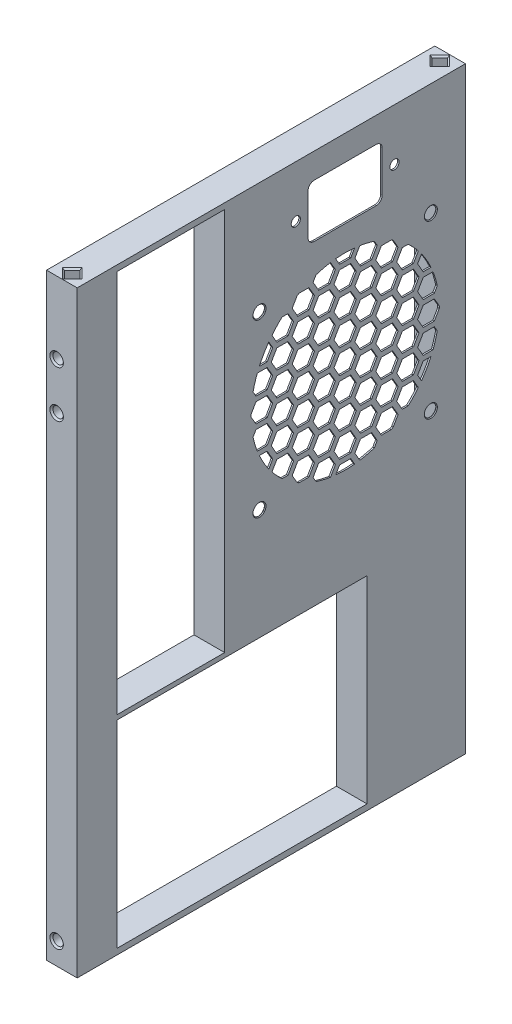
from build123d import *

# Parameters (mm, degrees)
SKETCH47_W                             = 160.866666667
SKETCH47_H                             = 247.65
SKETCH47_W_2                           = 44.704
SKETCH47_H_2                           = 159.004
SKETCH47_W_3                           = 103.7209
SKETCH47_H_3                           = 81.915
BOSS_EXTRUDE1_DEPTH                    = 12.7
BOSS_EXTRUDE6_DEPTH                    = 0.635
CUT_EXTRUDE4_REACH                     = 159.21
POWER_CABLE_ADAPTER_SCREWHOLES_D       = 3.7973
GPU_MOUNTING_SCREWHOLES_D              = 4.3053
GPU_MOUNTING_SCREWHOLES_DEPTH          = 4.572
GPU_MOUNTING_SCREWHOLES_CSINK_D        = 5.5753
GPU_MOUNTING_SCREWHOLES_CSINK_ANGLE    = 90
GPU_MOUNTING_SCREWHOLES_TIP            = 1.293442612
GPU_SCREW_ACCESS_HOLES_REACH           = 207.287
CUT_EXTRUDE1_REACH                     = 159.21
FILL_START                             = 12.065
FILL_PATTERN1_DEPTH                    = 0.635
SKETCH64_W                             = 82.922533333
SKETCH64_H                             = 128.9685
SKETCH64_R                             = 39
BOSS_EXTRUDE7_DEPTH                    = 0.635
F_3_16_0_1875_DIAMETER_HOLE1_D         = 4.7625
F_3_16_0_1875_DIAMETER_HOLE1_DEPTH     = 5.588
F_3_16_0_1875_DIAMETER_HOLE1_TIP       = 1.430799349
CHAMFER2_SIZE                          = 0.3175
BOTTOM_PINS_DEPTH                      = 6.35
FRONT_PINS_DEPTH                       = 6.35
CUT_EXTRUDE3_DEPTH                     = 6.35
PIN_CHAMFER_SIZE                       = 0.635
SKETCH69_W                             = 13.216466667
SKETCH69_H                             = 81.915
CUT_EXTRUDE2_DEPTH                     = 1.27
F_18_0_1695_DIAMETER_HOLE3_D           = 4.3053
F_18_0_1695_DIAMETER_HOLE3_DEPTH       = 8.382
F_18_0_1695_DIAMETER_HOLE3_CSINK_D     = 5.5753
F_18_0_1695_DIAMETER_HOLE3_CSINK_ANGLE = 90
F_18_0_1695_DIAMETER_HOLE3_TIP         = 1.293442612


# Read off the part's stored shape, not the designer's step: Fill Pattern1, #18 (0.1695) Diameter Hole2
with BuildPart() as part:
    # Sketch47 → Boss-Extrude1 (new body)
    with BuildSketch(Plane(origin=(0, 0, 0), x_dir=(0, 0, -1), z_dir=(1, 0, 0))):
        with Locations((11.578166667, 3.0734)):
            Rectangle(SKETCH47_W, SKETCH47_H)
        with Locations((-30.1117, 44.9834)):
            Rectangle(SKETCH47_W_2, SKETCH47_H_2, mode=Mode.SUBTRACT)
        Polygon((83.6295, 124.4854), (83.6295, -105.70845), (70.99935, -118.3386), (58.3692, -118.3386), (58.3692, -34.5186), (0.706966667, -34.5186), (0.706966667, 124.4854), align=None, mode=Mode.SUBTRACT)
        with Locations((-0.60325, -77.3811)):
            Rectangle(SKETCH47_W_3, SKETCH47_H_3, mode=Mode.SUBTRACT)
    extrude(amount=BOSS_EXTRUDE1_DEPTH)

    # Sketch50 → Boss-Extrude6 (add)
    with BuildSketch(Plane.ZY.offset(-12.7)):
        Polygon((-58.3692, -34.5186), (-58.3692, -118.3386), (-83.6295, -118.3386), (-83.6295, 124.4854), (-0.706966667, 124.4854), (-0.706966667, -34.5186), align=None)
    extrude(amount=BOSS_EXTRUDE6_DEPTH)

    # Sketch73 → Cut-Extrude4 (cut, up to next)
    with BuildSketch(Plane.ZY.offset(-12.065), mode=Mode.PRIVATE) as cut_extrude4_sk1:
        with BuildLine():
            Line((-26.801233333, 96.9899), (-26.801233333, 113.8809))
            ThreePointArc((-26.801233333, 113.8809), (-27.545182109, 115.676951224), (-29.341233333, 116.4209))
            Line((-29.341233333, 116.4209), (-54.995233333, 116.4209))
            ThreePointArc((-54.995233333, 116.4209), (-56.791284558, 115.676951224), (-57.535233333, 113.8809))
            Line((-57.535233333, 113.8809), (-57.535233333, 96.9899))
            ThreePointArc((-57.535233333, 96.9899), (-56.791284558, 95.193848776), (-54.995233333, 94.4499))
            Line((-54.995233333, 94.4499), (-29.341233333, 94.4499))
            ThreePointArc((-29.341233333, 94.4499), (-27.545182109, 95.193848776), (-26.801233333, 96.9899))
        make_face()
    cut_extrude4_tool1 = extrude(cut_extrude4_sk1.sketch, amount=-CUT_EXTRUDE4_REACH, mode=Mode.PRIVATE) & part.part
    add(cut_extrude4_tool1.solids().sort_by_distance((12.065, 105.4354, -42.168233))[0], mode=Mode.SUBTRACT)

    # power cable adapter screwholes (through all)
    with Locations(Plane.ZY.offset(-12.065)):
        with Locations((-62.615233333, 105.4354), (-21.721233333, 105.4354)):
            Hole(POWER_CABLE_ADAPTER_SCREWHOLES_D / 2)

    # GPU mounting screwholes
    with Locations(Plane(origin=(0, 0, -58.3692), x_dir=(-1, 0, 0), z_dir=(0, 0, -1))):
        with Locations((-5.08, -58.800000002), (-5.08, -79.120000002), (-5.08, -99.440000002), (-5.08, -38.354)):
            CounterSinkHole(GPU_MOUNTING_SCREWHOLES_D / 2, GPU_MOUNTING_SCREWHOLES_CSINK_D / 2, depth=GPU_MOUNTING_SCREWHOLES_DEPTH, counter_sink_angle=GPU_MOUNTING_SCREWHOLES_CSINK_ANGLE)
            with Locations((0, 0, -(GPU_MOUNTING_SCREWHOLES_DEPTH + GPU_MOUNTING_SCREWHOLES_TIP / 2))):  # 118° drill point
                Cone(0, GPU_MOUNTING_SCREWHOLES_D / 2, GPU_MOUNTING_SCREWHOLES_TIP, mode=Mode.SUBTRACT)

    # Sketch55 → GPU screw access holes (cut, up to next)
    with BuildSketch(Plane(origin=(0, 0, -92.0115), x_dir=(-1, 0, 0), z_dir=(0, 0, -1)), mode=Mode.PRIVATE) as gpu_screw_access_holes_sk1:
        Polygon((-0.680590949, -38.354), (-2.880295474, -34.544), (-7.279704526, -34.544), (-9.479409051, -38.354), (-7.279704526, -42.164), (-2.880295474, -42.164), align=None)
    gpu_screw_access_holes_tool1 = extrude(gpu_screw_access_holes_sk1.sketch, amount=-GPU_SCREW_ACCESS_HOLES_REACH, mode=Mode.PRIVATE) & part.part
    # Sketch55 → GPU screw access holes (cut, up to next)
    with BuildSketch(Plane(origin=(0, 0, -92.0115), x_dir=(-1, 0, 0), z_dir=(0, 0, -1)), mode=Mode.PRIVATE) as gpu_screw_access_holes_sk2:
        Polygon((-0.680590949, -58.800000002), (-2.880295474, -54.990000002), (-7.279704526, -54.990000002), (-9.479409051, -58.800000002), (-7.279704526, -62.610000002), (-2.880295474, -62.610000002), align=None)
    gpu_screw_access_holes_tool2 = extrude(gpu_screw_access_holes_sk2.sketch, amount=-GPU_SCREW_ACCESS_HOLES_REACH, mode=Mode.PRIVATE) & part.part
    # Sketch55 → GPU screw access holes (cut, up to next)
    with BuildSketch(Plane(origin=(0, 0, -92.0115), x_dir=(-1, 0, 0), z_dir=(0, 0, -1)), mode=Mode.PRIVATE) as gpu_screw_access_holes_sk3:
        Polygon((-0.680590949, -79.120000002), (-2.880295474, -75.310000002), (-7.279704526, -75.310000002), (-9.479409051, -79.120000002), (-7.279704526, -82.930000002), (-2.880295474, -82.930000002), align=None)
    gpu_screw_access_holes_tool3 = extrude(gpu_screw_access_holes_sk3.sketch, amount=-GPU_SCREW_ACCESS_HOLES_REACH, mode=Mode.PRIVATE) & part.part
    # Sketch55 → GPU screw access holes (cut, up to next)
    with BuildSketch(Plane(origin=(0, 0, -92.0115), x_dir=(-1, 0, 0), z_dir=(0, 0, -1)), mode=Mode.PRIVATE) as gpu_screw_access_holes_sk4:
        Polygon((-0.680590949, -99.440000002), (-2.880295474, -95.630000002), (-7.279704526, -95.630000002), (-9.479409051, -99.440000002), (-7.279704526, -103.250000002), (-2.880295474, -103.250000002), align=None)
    gpu_screw_access_holes_tool4 = extrude(gpu_screw_access_holes_sk4.sketch, amount=-GPU_SCREW_ACCESS_HOLES_REACH, mode=Mode.PRIVATE) & part.part
    add(gpu_screw_access_holes_tool1.solids().sort_by_distance((5.08, -38.354, -92.0115))[0], mode=Mode.SUBTRACT)
    add(gpu_screw_access_holes_tool2.solids().sort_by_distance((5.08, -58.8, -92.0115))[0], mode=Mode.SUBTRACT)
    add(gpu_screw_access_holes_tool3.solids().sort_by_distance((5.08, -79.12, -92.0115))[0], mode=Mode.SUBTRACT)
    add(gpu_screw_access_holes_tool4.solids().sort_by_distance((5.08, -99.44, -92.0115))[0], mode=Mode.SUBTRACT)

    # Sketch63 → Cut-Extrude1 (cut, up to next)
    with BuildSketch(Plane.ZY.offset(-12.065), mode=Mode.PRIVATE) as cut_extrude1_sk1:
        Polygon((-37.54943118, 44.9834), (-39.858832257, 48.9834), (-44.47763441, 48.9834), (-46.787035487, 44.9834), (-44.47763441, 40.9834), (-39.858832257, 40.9834), align=None)
    cut_extrude1_tool1 = extrude(cut_extrude1_sk1.sketch, amount=-CUT_EXTRUDE1_REACH, mode=Mode.PRIVATE) & part.part
    add(cut_extrude1_tool1.solids().sort_by_distance((12.065, 44.9834, -42.168233))[0], mode=Mode.SUBTRACT)

    # Fill Pattern1 outline → Fill Pattern1 (cut)
    with BuildSketch(Plane.YZ.offset(FILL_START)):
        Polygon((18.9834, -57.179340332), (14.9834, -54.869939256), (10.9834, -57.179340332), (10.9834, -61.798142486), (14.9834, -64.107543563), (18.9834, -61.798142486), align=None)
        Polygon((33.9834, -48.519086294), (29.9834, -46.209685218), (25.9834, -48.519086294), (25.9834, -53.137888448), (29.9834, -55.447289525), (33.9834, -53.137888448), align=None)
        Polygon((78.9834, -22.538324181), (74.9834, -20.228923104), (70.9834, -22.538324181), (70.9834, -27.157126334), (74.9834, -29.466527411), (78.9834, -27.157126334), align=None)
        Polygon((63.9834, -31.198578219), (59.9834, -28.889177142), (55.9834, -31.198578219), (55.9834, -35.817380372), (59.9834, -38.126781449), (63.9834, -35.817380372), align=None)
        Polygon((44.9834, -54.869939256), (40.9834, -57.179340332), (40.9834, -61.798142486), (44.9834, -64.107543563), (48.9834, -61.798142486), (48.9834, -57.179340332), align=None)
        Polygon((44.9834, -72.190447331), (40.9834, -74.499848408), (40.9834, -79.118650561), (44.9834, -81.428051638), (48.9834, -79.118650561), (48.9834, -74.499848408), align=None)
        Polygon((44.9834, -20.228923104), (40.9834, -22.538324181), (40.9834, -27.157126334), (44.9834, -29.466527411), (48.9834, -27.157126334), (48.9834, -22.538324181), align=None)
        Polygon((44.9834, -2.908415028), (40.9834, -5.217816105), (40.9834, -9.836618259), (44.9834, -12.146019335), (48.9834, -9.836618259), (48.9834, -5.217816105), align=None)
        Polygon((70.9834, -57.179340332), (70.9834, -61.798142486), (74.9834, -64.107543563), (78.9834, -61.798142486), (78.9834, -57.179340332), (74.9834, -54.869939256), align=None)
        Polygon((55.9834, -48.519086294), (55.9834, -53.137888448), (59.9834, -55.447289525), (63.9834, -53.137888448), (63.9834, -48.519086294), (59.9834, -46.209685218), align=None)
        Polygon((10.9834, -22.538324181), (10.9834, -27.157126334), (14.9834, -29.466527411), (18.9834, -27.157126334), (18.9834, -22.538324181), (14.9834, -20.228923104), align=None)
        Polygon((25.9834, -31.198578219), (25.9834, -35.817380372), (29.9834, -38.126781449), (33.9834, -35.817380372), (33.9834, -31.198578219), (29.9834, -28.889177142), align=None)
        Polygon((28.9834, -5.217816105), (24.9834, -2.908415028), (20.9834, -5.217816105), (20.9834, -9.836618259), (24.9834, -12.146019335), (28.9834, -9.836618259), align=None)
        Polygon((24.9834, -54.869939256), (20.9834, -57.179340332), (20.9834, -61.798142486), (24.9834, -64.107543563), (28.9834, -61.798142486), (28.9834, -57.179340332), align=None)
        Polygon((24.9834, -72.190447331), (20.9834, -74.499848408), (20.9834, -79.118650561), (24.9834, -81.428051638), (28.9834, -79.118650561), (28.9834, -74.499848408), align=None)
        Polygon((24.9834, -20.228923104), (20.9834, -22.538324181), (20.9834, -27.157126334), (24.9834, -29.466527411), (28.9834, -27.157126334), (28.9834, -22.538324181), align=None)
        Polygon((24.9834, -37.54943118), (20.9834, -39.858832257), (20.9834, -44.47763441), (24.9834, -46.787035487), (28.9834, -44.47763441), (28.9834, -39.858832257), align=None)
        Polygon((80.9834, -39.858832257), (80.9834, -44.47763441), (84.9834, -46.787035487), (88.9834, -44.47763441), (88.9834, -39.858832257), (84.9834, -37.54943118), align=None)
        Polygon((50.9834, -22.538324181), (50.9834, -27.157126334), (54.9834, -29.466527411), (58.9834, -27.157126334), (58.9834, -22.538324181), (54.9834, -20.228923104), align=None)
        Polygon((35.9834, -13.878070143), (35.9834, -18.496872297), (39.9834, -20.806273373), (43.9834, -18.496872297), (43.9834, -13.878070143), (39.9834, -11.568669066), align=None)
        Polygon((65.9834, -31.198578219), (65.9834, -35.817380372), (69.9834, -38.126781449), (73.9834, -35.817380372), (73.9834, -31.198578219), (69.9834, -28.889177142), align=None)
        Polygon((38.9834, -57.179340332), (34.9834, -54.869939256), (30.9834, -57.179340332), (30.9834, -61.798142486), (34.9834, -64.107543563), (38.9834, -61.798142486), align=None)
        Polygon((53.9834, -48.519086294), (49.9834, -46.209685218), (45.9834, -48.519086294), (45.9834, -53.137888448), (49.9834, -55.447289525), (53.9834, -53.137888448), align=None)
        Polygon((23.9834, -65.83959437), (19.9834, -63.530193293), (15.9834, -65.83959437), (15.9834, -70.458396524), (19.9834, -72.7677976), (23.9834, -70.458396524), align=None)
        Polygon((83.9834, -31.198578219), (79.9834, -28.889177142), (75.9834, -31.198578219), (75.9834, -35.817380372), (79.9834, -38.126781449), (83.9834, -35.817380372), align=None)
        Polygon((68.9834, -39.858832257), (64.9834, -37.54943118), (60.9834, -39.858832257), (60.9834, -44.47763441), (64.9834, -46.787035487), (68.9834, -44.47763441), align=None)
        Polygon((34.9834, -72.190447331), (30.9834, -74.499848408), (30.9834, -79.118650561), (34.9834, -81.428051638), (38.9834, -79.118650561), (38.9834, -74.499848408), align=None)
        Polygon((34.9834, -20.228923104), (30.9834, -22.538324181), (30.9834, -27.157126334), (34.9834, -29.466527411), (38.9834, -27.157126334), (38.9834, -22.538324181), align=None)
        Polygon((34.9834, -2.908415028), (30.9834, -5.217816105), (30.9834, -9.836618259), (34.9834, -12.146019335), (38.9834, -9.836618259), (38.9834, -5.217816105), align=None)
        Polygon((34.9834, -37.54943118), (30.9834, -39.858832257), (30.9834, -44.47763441), (34.9834, -46.787035487), (38.9834, -44.47763441), (38.9834, -39.858832257), align=None)
        Polygon((15.9834, -48.519086294), (15.9834, -53.137888448), (19.9834, -55.447289525), (23.9834, -53.137888448), (23.9834, -48.519086294), (19.9834, -46.209685218), align=None)
        Polygon((60.9834, -74.499848408), (60.9834, -79.118650561), (64.9834, -81.428051638), (68.9834, -79.118650561), (68.9834, -74.499848408), (64.9834, -72.190447331), align=None)
        Polygon((45.9834, -65.83959437), (45.9834, -70.458396524), (49.9834, -72.7677976), (53.9834, -70.458396524), (53.9834, -65.83959437), (49.9834, -63.530193293), align=None)
        Polygon((0.9834, -39.858832257), (0.9834, -44.47763441), (4.9834, -46.787035487), (8.9834, -44.47763441), (8.9834, -39.858832257), (4.9834, -37.54943118), align=None)
        Polygon((43.9834, -48.519086294), (39.9834, -46.209685218), (35.9834, -48.519086294), (35.9834, -53.137888448), (39.9834, -55.447289525), (43.9834, -53.137888448), align=None)
        Polygon((58.9834, -39.858832257), (54.9834, -37.54943118), (50.9834, -39.858832257), (50.9834, -44.47763441), (54.9834, -46.787035487), (58.9834, -44.47763441), align=None)
        Polygon((5.9834, -48.519086294), (5.9834, -53.137888448), (9.9834, -55.447289525), (13.9834, -53.137888448), (13.9834, -48.519086294), (9.9834, -46.209685218), align=None)
        Polygon((50.9834, -74.499848408), (50.9834, -79.118650561), (54.9834, -81.428051638), (58.9834, -79.118650561), (58.9834, -74.499848408), (54.9834, -72.190447331), align=None)
        Polygon((35.9834, -65.83959437), (35.9834, -70.458396524), (39.9834, -72.7677976), (43.9834, -70.458396524), (43.9834, -65.83959437), (39.9834, -63.530193293), align=None)
        Polygon((14.9834, -37.54943118), (10.9834, -39.858832257), (10.9834, -44.47763441), (14.9834, -46.787035487), (18.9834, -44.47763441), (18.9834, -39.858832257), align=None)
        Polygon((25.9834, -65.83959437), (25.9834, -70.458396524), (29.9834, -72.7677976), (33.9834, -70.458396524), (33.9834, -65.83959437), (29.9834, -63.530193293), align=None)
        Polygon((83.9834, -48.519086294), (79.9834, -46.209685218), (75.9834, -48.519086294), (75.9834, -53.137888448), (79.9834, -55.447289525), (83.9834, -53.137888448), align=None)
        Polygon((68.9834, -57.179340332), (64.9834, -54.869939256), (60.9834, -57.179340332), (60.9834, -61.798142486), (64.9834, -64.107543563), (68.9834, -61.798142486), align=None)
        Polygon((15.9834, -13.878070143), (15.9834, -18.496872297), (19.9834, -20.806273373), (23.9834, -18.496872297), (23.9834, -13.878070143), (19.9834, -11.568669066), align=None)
        Polygon((45.9834, -31.198578219), (45.9834, -35.817380372), (49.9834, -38.126781449), (53.9834, -35.817380372), (53.9834, -31.198578219), (49.9834, -28.889177142), align=None)
        Polygon((78.9834, -39.858832257), (74.9834, -37.54943118), (70.9834, -39.858832257), (70.9834, -44.47763441), (74.9834, -46.787035487), (78.9834, -44.47763441), align=None)
        Polygon((55.9834, -65.83959437), (55.9834, -70.458396524), (59.9834, -72.7677976), (63.9834, -70.458396524), (63.9834, -65.83959437), (59.9834, -63.530193293), align=None)
        Polygon((58.9834, -57.179340332), (54.9834, -54.869939256), (50.9834, -57.179340332), (50.9834, -61.798142486), (54.9834, -64.107543563), (58.9834, -61.798142486), align=None)
        Polygon((73.9834, -48.519086294), (69.9834, -46.209685218), (65.9834, -48.519086294), (65.9834, -53.137888448), (69.9834, -55.447289525), (73.9834, -53.137888448), align=None)
        Polygon((54.9834, -2.908415028), (50.9834, -5.217816105), (50.9834, -9.836618259), (54.9834, -12.146019335), (58.9834, -9.836618259), (58.9834, -5.217816105), align=None)
        Polygon((65.9834, -65.83959437), (65.9834, -70.458396524), (69.9834, -72.7677976), (73.9834, -70.458396524), (73.9834, -65.83959437), (69.9834, -63.530193293), align=None)
        Polygon((5.9834, -31.198578219), (5.9834, -35.817380372), (9.9834, -38.126781449), (13.9834, -35.817380372), (13.9834, -31.198578219), (9.9834, -28.889177142), align=None)
        Polygon((64.9834, -20.228923104), (60.9834, -22.538324181), (60.9834, -27.157126334), (64.9834, -29.466527411), (68.9834, -27.157126334), (68.9834, -22.538324181), align=None)
        Polygon((64.9834, -2.908415028), (60.9834, -5.217816105), (60.9834, -9.836618259), (64.9834, -12.146019335), (68.9834, -9.836618259), (68.9834, -5.217816105), align=None)
        Polygon((15.9834, -31.198578219), (15.9834, -35.817380372), (19.9834, -38.126781449), (23.9834, -35.817380372), (23.9834, -31.198578219), (19.9834, -28.889177142), align=None)
        Polygon((29.9834, -11.568669066), (25.9834, -13.878070143), (25.9834, -18.496872297), (29.9834, -20.806273373), (33.9834, -18.496872297), (33.9834, -13.878070143), align=None)
        Polygon((73.9834, -13.878070143), (69.9834, -11.568669066), (65.9834, -13.878070143), (65.9834, -18.496872297), (69.9834, -20.806273373), (73.9834, -18.496872297), align=None)
        Polygon((43.9834, -31.198578219), (39.9834, -28.889177142), (35.9834, -31.198578219), (35.9834, -35.817380372), (39.9834, -38.126781449), (43.9834, -35.817380372), align=None)
        Polygon((49.9834, -11.568669066), (45.9834, -13.878070143), (45.9834, -18.496872297), (49.9834, -20.806273373), (53.9834, -18.496872297), (53.9834, -13.878070143), align=None)
        Polygon((59.9834, -11.568669066), (55.9834, -13.878070143), (55.9834, -18.496872297), (59.9834, -20.806273373), (63.9834, -18.496872297), (63.9834, -13.878070143), align=None)
    extrude(amount=FILL_PATTERN1_DEPTH, mode=Mode.SUBTRACT)

    # Sketch64 → Boss-Extrude7 (add)
    with BuildSketch(Plane.ZY.offset(-12.065)):
        with Locations((-42.168233334, 29.96565)):
            Rectangle(SKETCH64_W, SKETCH64_H)
        with Locations((-42.168233333, 44.9834)):
            Circle(SKETCH64_R, mode=Mode.SUBTRACT)
    extrude(amount=-BOSS_EXTRUDE7_DEPTH)

    # 3/16 (0.1875) Diameter Hole1
    with Locations(Plane.ZY.offset(-12.065)):
        with Locations((-77.668233333, 80.4834), (-6.668233333, 80.4834), (-6.668233333, 9.4834), (-77.668233333, 9.4834)):
            Hole(F_3_16_0_1875_DIAMETER_HOLE1_D / 2, depth=F_3_16_0_1875_DIAMETER_HOLE1_DEPTH)
            with Locations((0, 0, -(F_3_16_0_1875_DIAMETER_HOLE1_DEPTH + F_3_16_0_1875_DIAMETER_HOLE1_TIP / 2))):  # 118° drill point
                Cone(0, F_3_16_0_1875_DIAMETER_HOLE1_D / 2, F_3_16_0_1875_DIAMETER_HOLE1_TIP, mode=Mode.SUBTRACT)

    # Chamfer2
    chamfer2_edges = [part.edges().sort_by_distance(p)[0] for p in [
        (12.7, 9.4834, -75.286983333),
        (12.065, 9.4834, -75.286983333),
        (12.7, 9.4834, -4.286983333),
        (12.065, 9.4834, -4.286983333),
        (12.7, 80.4834, -4.286983333),
        (12.065, 80.4834, -4.286983333),
        (12.7, 80.4834, -75.286983333),
        (12.065, 80.4834, -75.286983333),
    ]]
    chamfer(chamfer2_edges, length=CHAMFER2_SIZE - 0.0001)  # a hair under: the kernel refuses the full size

    # Sketch60 → bottom pins (cut)
    with BuildSketch(Plane.XZ.offset(120.7516)):
        Polygon((9.525, 64.621833333), (6.35, 61.446833333), (3.175, 64.621833333), (6.35, 67.796833333), align=None)
        Polygon((3.175, -87.778166667), (6.35, -84.603166667), (9.525, -87.778166667), (6.35, -90.953166667), align=None)
    extrude(amount=-BOTTOM_PINS_DEPTH, mode=Mode.SUBTRACT)

    # Sketch61 → front pins (cut)
    with BuildSketch(Plane(origin=(0, 0, 0), x_dir=(0, 0, -1), z_dir=(1, 0, 0))):
        Polygon((84.603166667, 115.57), (87.778166667, 118.745), (90.953166667, 115.57), (87.778166667, 112.395), align=None)
        Polygon((-64.621833333, 118.745), (-61.446833333, 115.57), (-64.621833333, 112.395), (-67.796833333, 115.57), align=None)
        Polygon((84.603166667, 88.7984), (87.778166667, 91.9734), (90.953166667, 88.7984), (87.778166667, 85.6234), align=None)
    extrude(amount=FRONT_PINS_DEPTH, mode=Mode.SUBTRACT)

    # Sketch72 → Cut-Extrude3 (cut)
    with BuildSketch(Plane(origin=(0, 126.8984, 0), x_dir=(1, 0, 0), z_dir=(0, 1, 0))):
        Polygon((9.525, 87.778166667), (6.35, 84.603166667), (3.175, 87.778166667), (6.35, 90.953166667), align=None)
        Polygon((9.525, -64.621833333), (6.35, -67.796833333), (3.175, -64.621833333), (6.35, -61.446833333), align=None)
    extrude(amount=-CUT_EXTRUDE3_DEPTH, mode=Mode.SUBTRACT)

    # pin chamfer
    pin_chamfer_edges = [part.edges().sort_by_distance(p)[0] for p in [
        (7.9375, -114.4016, 66.209333333),
        (7.9375, -114.4016, 63.034333333),
        (4.7625, -114.4016, 63.034333333),
        (4.7625, -114.4016, 66.209333333),
        (7.9375, -120.7516, 66.209333333),
        (4.7625, -120.7516, 66.209333333),
        (4.7625, -120.7516, 63.034333333),
        (7.9375, -120.7516, 63.034333333),
        (4.7625, -114.4016, -89.365666667),
        (4.7625, -114.4016, -86.190666667),
        (7.9375, -114.4016, -86.190666667),
        (7.9375, -114.4016, -89.365666667),
        (4.7625, -120.7516, -89.365666667),
        (7.9375, -120.7516, -89.365666667),
        (7.9375, -120.7516, -86.190666667),
        (4.7625, -120.7516, -86.190666667),
        (0, 87.2109, -86.190666667),
        (0, 87.2109, -89.365666667),
        (0, 90.3859, -89.365666667),
        (0, 90.3859, -86.190666667),
        (6.35, 87.2109, -86.190666667),
        (6.35, 87.2109, -89.365666667),
        (6.35, 90.3859, -89.365666667),
        (6.35, 90.3859, -86.190666667),
        (0, 117.1575, 66.209333333),
        (0, 113.9825, 66.209333333),
        (0, 113.9825, 63.034333333),
        (0, 117.1575, 63.034333333),
        (6.35, 117.1575, 66.209333333),
        (6.35, 113.9825, 66.209333333),
        (6.35, 113.9825, 63.034333333),
        (6.35, 117.1575, 63.034333333),
        (0, 113.9825, -86.190666667),
        (0, 113.9825, -89.365666667),
        (0, 117.1575, -89.365666667),
        (0, 117.1575, -86.190666667),
        (6.35, 113.9825, -86.190666667),
        (6.35, 113.9825, -89.365666667),
        (6.35, 117.1575, -89.365666667),
        (6.35, 117.1575, -86.190666667),
        (7.9375, 120.5484, -89.365666667),
        (7.9375, 120.5484, -86.190666667),
        (4.7625, 120.5484, -86.190666667),
        (4.7625, 120.5484, -89.365666667),
        (7.9375, 126.8984, -89.365666667),
        (4.7625, 126.8984, -89.365666667),
        (4.7625, 126.8984, -86.190666667),
        (7.9375, 126.8984, -86.190666667),
        (7.9375, 120.5484, 63.034333333),
        (7.9375, 120.5484, 66.209333333),
        (4.7625, 120.5484, 66.209333333),
        (4.7625, 120.5484, 63.034333333),
        (7.9375, 126.8984, 63.034333333),
        (4.7625, 126.8984, 63.034333333),
        (4.7625, 126.8984, 66.209333333),
        (7.9375, 126.8984, 66.209333333),
    ]]
    chamfer(pin_chamfer_edges, length=PIN_CHAMFER_SIZE)

    # Sketch69 → Cut-Extrude2 (cut)
    with BuildSketch(Plane.ZY):
        with Locations((59.071933334, -77.3811)):
            Rectangle(SKETCH69_W, SKETCH69_H)
    extrude(amount=-CUT_EXTRUDE2_DEPTH, mode=Mode.SUBTRACT)

    # #18 (0.1695) Diameter Hole3
    with Locations(Plane.XY.offset(68.855166667)):
        with Locations((4.183016872, 77.703402), (4.183016872, -111.726599), (4.183016872, 97.0534)):
            CounterSinkHole(F_18_0_1695_DIAMETER_HOLE3_D / 2, F_18_0_1695_DIAMETER_HOLE3_CSINK_D / 2, depth=F_18_0_1695_DIAMETER_HOLE3_DEPTH, counter_sink_angle=F_18_0_1695_DIAMETER_HOLE3_CSINK_ANGLE)
            with Locations((0, 0, -(F_18_0_1695_DIAMETER_HOLE3_DEPTH + F_18_0_1695_DIAMETER_HOLE3_TIP / 2))):  # 118° drill point
                Cone(0, F_18_0_1695_DIAMETER_HOLE3_D / 2, F_18_0_1695_DIAMETER_HOLE3_TIP, mode=Mode.SUBTRACT)

    # #18 (0.1695) Diameter Hole2 outline → #18 (0.1695) Diameter Hole2 (revolve, cut)
    with BuildSketch(Plane(origin=(4.183016872, 97.0534, 0), x_dir=(1, 0, 0), z_dir=(0, -1, 0))):
        Polygon((2.15265, -91.3765), (2.15265, -83.6295), (0, -83.6295), (0, -92.0115), (2.78765, -92.0115), align=None)
    revolve(axis=Axis((4.183016872, 97.0534, 0), (0, 0, 1)), mode=Mode.SUBTRACT)

    # 18 _0.1695_ Diameter Hole2 2 outline → 18 _0.1695_ Diameter Hole2 2 (revolve, cut)
    with BuildSketch(Plane(origin=(4.175, -111.726599, 0), x_dir=(1, 0, 0), z_dir=(0, -1, 0))):
        Polygon((2.15265, -83.6295), (0, -82.336057388), (0, -92.0115), (2.78765, -92.0115), (2.15265, -91.3765), align=None)
    revolve(axis=Axis((4.175, -111.726599, 0), (0, 0, 1)), mode=Mode.SUBTRACT)

    # 18 _0.1695_ Diameter Hole2 3 outline → 18 _0.1695_ Diameter Hole2 3 (revolve, cut)
    with BuildSketch(Plane(origin=(4.375001, 77.703402, 0), x_dir=(1, 0, 0), z_dir=(0, -1, 0))):
        Polygon((2.15265, -91.3765), (2.15265, -83.6295), (0, -83.6295), (0, -92.0115), (2.78765, -92.0115), align=None)
    revolve(axis=Axis((4.375001, 77.703402, 0), (0, 0, 1)), mode=Mode.SUBTRACT)


solid = part.part
